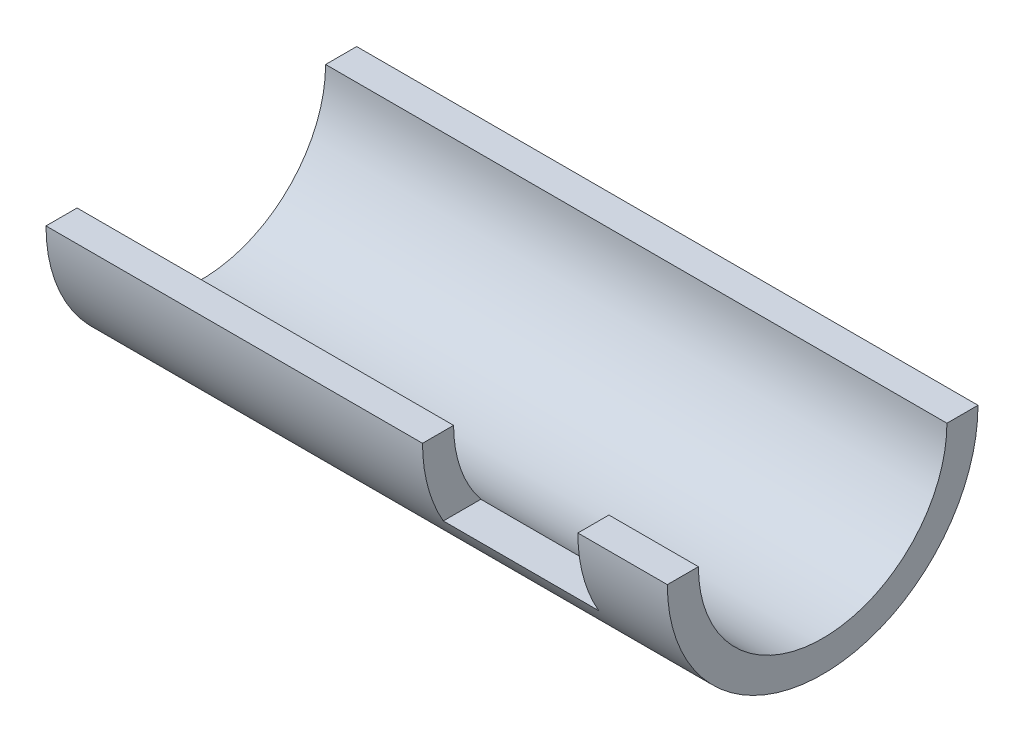
from build123d import *

# Parameters (mm, degrees)
BOSS_EXTRUDE1_DEPTH = 127
SKETCH2_W           = 31.75
SKETCH2_H           = 15.875
CUT_EXTRUDE1_DEPTH  = 127


with BuildPart() as part:
    # Sketch1 → Boss-Extrude1 (new body)
    with BuildSketch(Plane(origin=(0, 0, 0), x_dir=(0, 0, -1), z_dir=(1, 0, 0))):
        with BuildLine():
            Line((-25.4, 0), (-31.75, 0))
            ThreePointArc((-31.75, 0), (0, -31.75), (31.75, 0))
            Line((31.75, 0), (25.4, 0))
            ThreePointArc((25.4, 0), (0, -25.4), (-25.4, 0))
        make_face()
    extrude(amount=-BOSS_EXTRUDE1_DEPTH)

    # Sketch2 → Cut-Extrude1 (cut)
    with BuildSketch(Plane.XY):
        with Locations((-34.163, -7.9375)):
            Rectangle(SKETCH2_W, SKETCH2_H)
    extrude(amount=CUT_EXTRUDE1_DEPTH, mode=Mode.SUBTRACT)


solid = part.part
